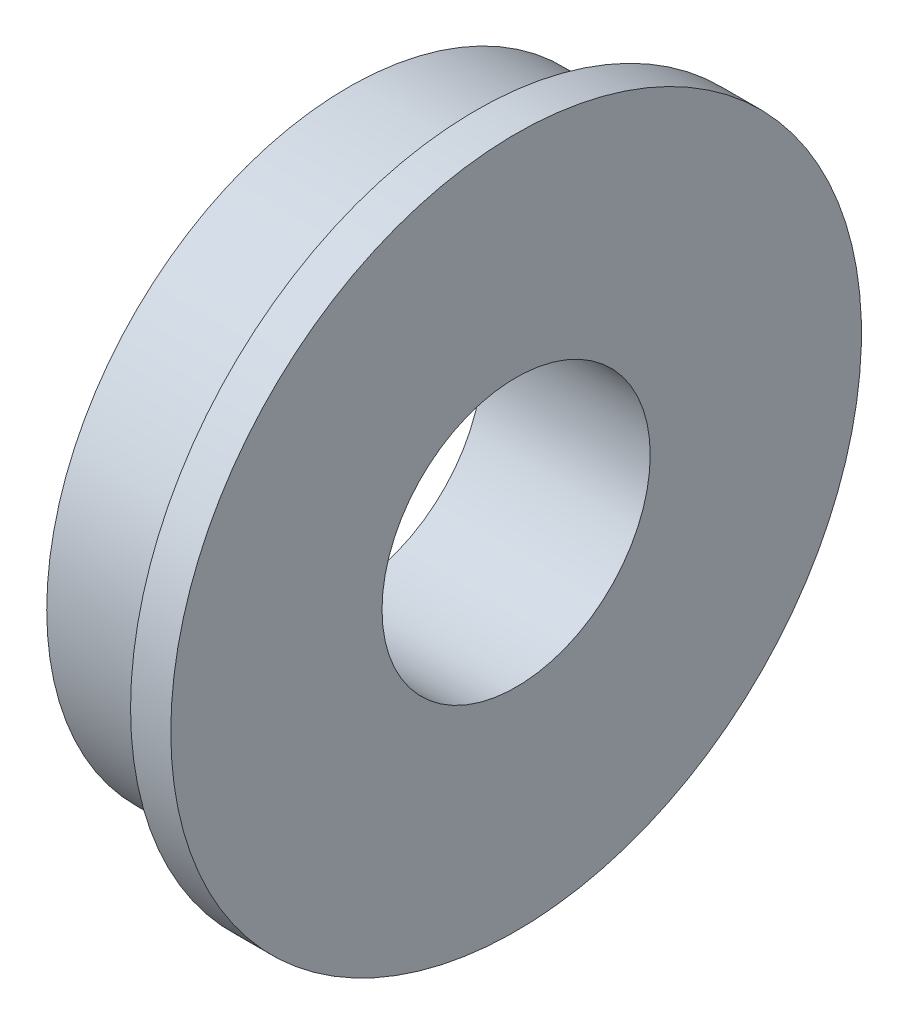
from build123d import *


with BuildPart() as part:
    # Esquisse1 → Révolution1 (revolve)
    with BuildSketch(Plane.XY):
        Polygon((0, 2), (2.5, 2), (2.5, 5.15), (1.9, 5.15), (1.9, 4.5), (0, 4.5), align=None)
    revolve(axis=Axis((0, 0, 0), (1, 0, 0)))


solid = part.part
